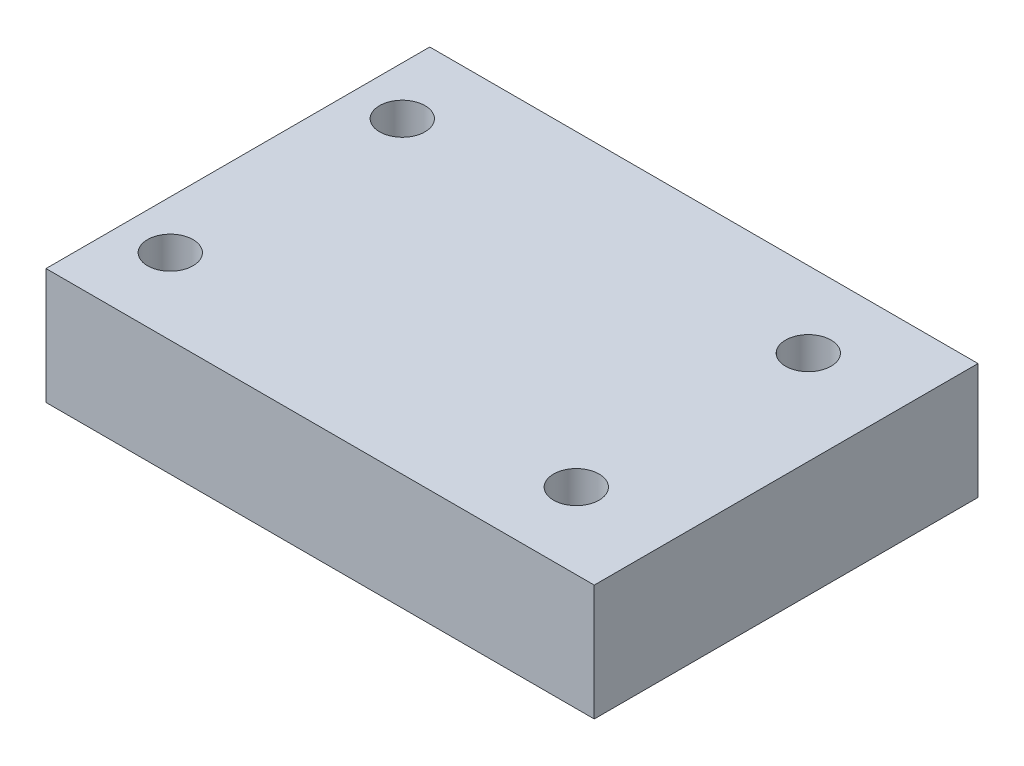
from build123d import *

# Parameters (mm, degrees)
SKETCH1_W              = 60.0202
SKETCH1_H              = 42.0116
BOSS_EXTRUDE1_DEPTH    = 12.7
F_10_CLEARANCE_HOLE1_D = 4.9784


with BuildPart() as part:
    # Sketch1 → Boss-Extrude1 (new body)
    with BuildSketch(Plane(origin=(0, 0, 0), x_dir=(1, 0, 0), z_dir=(0, 1, 0))):
        Rectangle(SKETCH1_W, SKETCH1_H)
    extrude(amount=BOSS_EXTRUDE1_DEPTH)

    # #10 Clearance Hole1 (through all)
    with Locations(Plane(origin=(0, 12.7, 0), x_dir=(1, 0, 0), z_dir=(0, 1, 0))):
        with Locations((-24.7101106, 12.7), (-24.7101106, -12.7), (19.7398894, -12.7), (19.7398894, 12.7)):
            Hole(F_10_CLEARANCE_HOLE1_D / 2)


solid = part.part
